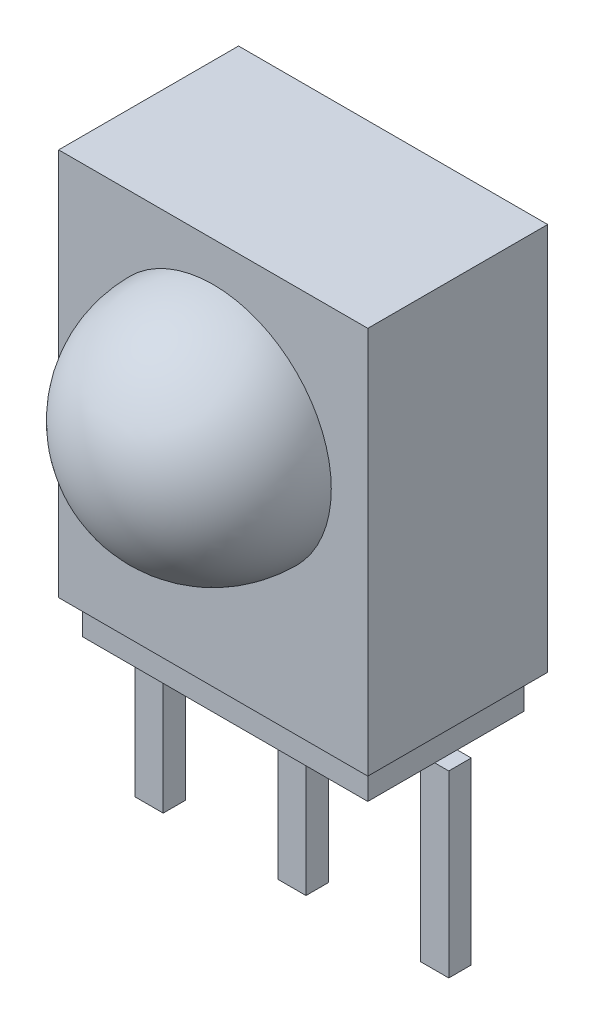
from build123d import *

# Parameters (mm, degrees)
SKETCH1_W           = 5.5
SKETCH1_H           = 6.9
BOSS_EXTRUDE1_DEPTH = 3.2
SKETCH4_R           = 2.1
BOSS_EXTRUDE2_DEPTH = 2.1
FILLET1_R           = 2.1
SKETCH5_W           = 5.08
SKETCH5_H           = 2.78
BOSS_EXTRUDE3_DEPTH = 0.6
SKETCH7_W           = 0.5
SKETCH7_H           = 0.4
BOSS_EXTRUDE5_DEPTH = 3.19
LPATTERN1_COUNT     = 2
LPATTERN1_PITCH     = 2.54
LPATTERN1_COL_COUNT = 2
LPATTERN1_COL_PITCH = 2.54


with BuildPart() as part:
    # Sketch1 → Boss-Extrude1 (new body)
    with BuildSketch(Plane.XY):
        with Locations((2.75, 3.45)):
            Rectangle(SKETCH1_W, SKETCH1_H)
    extrude(amount=BOSS_EXTRUDE1_DEPTH)

    # Sketch4 → Boss-Extrude2 (add)
    with BuildSketch(Plane.XY.offset(3.2)):
        with Locations(Location((2.75, 4.1, 0), (0, 0, 180))):
            Circle(SKETCH4_R)
    extrude(amount=BOSS_EXTRUDE2_DEPTH)

    # Fillet1
    fillet1_edges = [part.edges().sort_by_distance(p)[0] for p in [
        (4.85, 4.1, 5.3),
    ]]
    fillet(fillet1_edges, radius=FILLET1_R - 0.0001)  # a hair under: the kernel refuses the full size

    # Sketch5 → Boss-Extrude3 (add)
    with BuildSketch(Plane.XZ):
        with Locations((2.75, 1.6)):
            Rectangle(SKETCH5_W, SKETCH5_H)
    extrude(amount=BOSS_EXTRUDE3_DEPTH)

    # Sketch7 → Boss-Extrude5 (add)
    with BuildSketch(Plane.XZ.offset(0.6)):
        with Locations((2.75, 1.6)):
            Rectangle(SKETCH7_W, SKETCH7_H)
    boss_extrude5 = extrude(amount=BOSS_EXTRUDE5_DEPTH)

    # LPattern1: Boss-Extrude5 ×2
    with Locations(*[(-i * LPATTERN1_PITCH, 0, 0) for i in range(1, LPATTERN1_COUNT)]):
        add(boss_extrude5)

    # LPattern1 col: Boss-Extrude5 ×2
    with Locations(*[(i * LPATTERN1_COL_PITCH, 0, 0) for i in range(1, LPATTERN1_COL_COUNT)]):
        add(boss_extrude5)


solid = part.part
